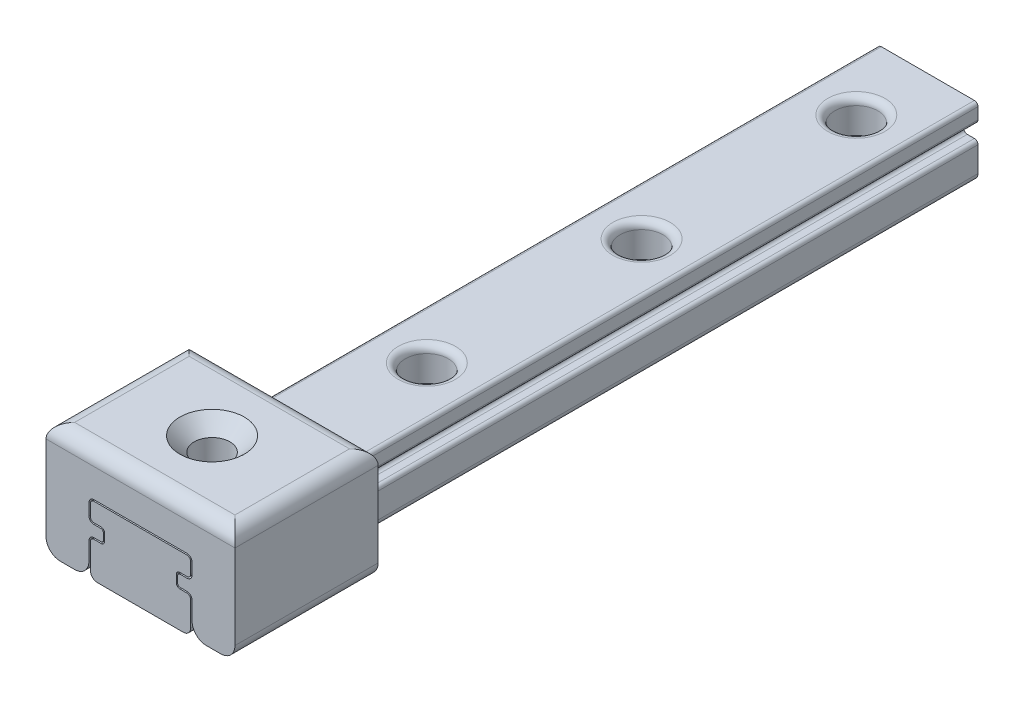
from build123d import *

# Parameters (mm, degrees)
EXTRUDE_1_DEPTH                = 80
FILLET_1_R                     = 0.25
FILLET_2_R                     = 0.5
SKETCH_2_R                     = 1.5
CUT_EXTRUDE_1_DEPTH            = 2.3
SKETCH_3_R                     = 1.2
CUT_EXTRUDE_2_DEPTH            = 81.344570445
FILLET_3_R                     = 0.5
PATTERN_LINEAR_2_COUNT         = 6
PATTERN_LINEAR_2_PITCH         = 15
FILLET_3_OF_PATTERN_LINEAR_2_R = 0.5
SKETCH_4_W                     = 7.607362056
SKETCH_4_H                     = 5.534224128
CUT_EXTRUDE_3_DEPTH            = 25
EXTRUDE_START                  = -55
EXTRUDE_2_DEPTH                = 10
FILLET_4_R                     = 1
MM_START                       = 4.9
MM_1_OUTLINE_R                 = 1.25
MM_1_DEPTH                     = 3
CHAMFER_1_SIZE                 = 1


# Read off the part's stored shape, not the designer's step: 大小mm 暗销孔1
with BuildPart() as part:
    # 草图1 → 凸台-拉伸1 (new body)
    with BuildSketch(Plane.XY):
        Polygon((7, 2.5), (7, 0), (0, 0), (0, 2.5), (1, 2.5), (1, 3.5), (0, 3.5), (0, 4.8), (7, 4.8), (7, 3.5), (6, 3.5), (6, 2.5), align=None)
    extrude(amount=EXTRUDE_1_DEPTH)

    # 圆角1
    fillet_1_edges = [part.edges().sort_by_distance(p)[0] for p in [
        (0, 2.5, 40),
        (1, 2.5, 40),
        (1, 3.5, 40),
        (0, 3.5, 40),
        (0, 4.8, 40),
        (7, 4.8, 40),
        (7, 3.5, 40),
        (6, 3.5, 40),
        (6, 2.5, 40),
        (7, 2.5, 40),
    ]]
    fillet(fillet_1_edges, radius=FILLET_1_R)

    # 圆角2
    fillet_2_edges = [part.edges().sort_by_distance(p)[0] for p in [
        (7, 0, 40),
        (0, 0, 40),
    ]]
    fillet(fillet_2_edges, radius=FILLET_2_R)

    # 草图2 → 切除-拉伸1 (cut)
    with BuildSketch(Plane(origin=(0, 4.8, 0), x_dir=(1, 0, 0), z_dir=(0, 1, 0))):
        with Locations(Location((3.5, -5, 0), (0, 0, 270))):
            Circle(SKETCH_2_R)
    cut_extrude_1 = extrude(amount=-CUT_EXTRUDE_1_DEPTH, mode=Mode.SUBTRACT)

    # 草图3 → 切除-拉伸2 (cut, through all)
    with BuildSketch(Plane(origin=(0, 2.5, 0), x_dir=(1, 0, 0), z_dir=(0, 1, 0))):
        with Locations(Location((3.5, -5, 0), (0, 0, 270))):
            Circle(SKETCH_3_R)
    cut_extrude_2 = extrude(amount=-CUT_EXTRUDE_2_DEPTH, mode=Mode.SUBTRACT)

    # 圆角3
    fillet_3_edges = [part.edges().sort_by_distance(p)[0] for p in [
        (3.5, 4.8, 3.5),
    ]]
    fillet(fillet_3_edges, radius=FILLET_3_R)

    # 阵列(线性)2: 切除-拉伸1, 切除-拉伸2 ×6
    with Locations(*[(0, 0, i * PATTERN_LINEAR_2_PITCH) for i in range(1, PATTERN_LINEAR_2_COUNT)]):
        add(cut_extrude_1, mode=Mode.SUBTRACT)
        add(cut_extrude_2, mode=Mode.SUBTRACT)

    # 圆角3 of 阵列(线性)2
    fillet_3_of_pattern_linear_2_edges = [part.edges().sort_by_distance(p)[0] for p in [
        (3.5, 4.8, 18.5),
        (3.5, 4.8, 33.5),
        (3.5, 4.8, 48.5),
        (3.5, 4.8, 63.5),
        (3.5, 4.8, 78.5),
    ]]
    fillet(fillet_3_of_pattern_linear_2_edges, radius=FILLET_3_OF_PATTERN_LINEAR_2_R)

    # 草图4 → 切除-拉伸3 (cut)
    with BuildSketch(Plane.XY.offset(80)):
        with Locations((3.651776821, 2.327683724)):
            Rectangle(SKETCH_4_W, SKETCH_4_H)
    extrude(amount=-CUT_EXTRUDE_3_DEPTH, mode=Mode.SUBTRACT)


with BuildPart() as body_2:
    # 草图5 → 凸台-拉伸2 (new body)
    with BuildSketch(Plane(origin=(0, 0, 0), x_dir=(-1, 0, 0), z_dir=(0, 0, -1)).offset(EXTRUDE_START)):
        with BuildLine():
            ThreePointArc((0.1, 4.55), (-0.002512627, 4.797487373), (-0.25, 4.9))
            Line((-0.25, 4.9), (-6.75, 4.9))
            ThreePointArc((-6.75, 4.9), (-6.997487373, 4.797487373), (-7.1, 4.55))
            Line((-7.1, 4.55), (-7.1, 3.75))
            ThreePointArc((-7.1, 3.75), (-6.997487373, 3.502512627), (-6.75, 3.4))
            Line((-6.75, 3.4), (-6.25, 3.4))
            ThreePointArc((-6.25, 3.4), (-6.143933983, 3.356066017), (-6.1, 3.25))
            Line((-6.1, 3.25), (-6.1, 2.75))
            ThreePointArc((-6.1, 2.75), (-6.143933983, 2.643933983), (-6.25, 2.6))
            Line((-6.25, 2.6), (-6.75, 2.6))
            ThreePointArc((-6.75, 2.6), (-6.997487373, 2.497487373), (-7.1, 2.25))
            Line((-7.1, 2.25), (-7.1, 0))
            Line((-7.1, 0), (-10.1, 0))
            Line((-10.1, 0), (-10.1, 7.9))
            Line((-10.1, 7.9), (3.1, 7.9))
            Line((3.1, 7.9), (3.1, 0))
            Line((3.1, 0), (0.1, 0))
            Line((0.1, 0), (0.1, 2.25))
            ThreePointArc((0.1, 2.25), (-0.002512627, 2.497487373), (-0.25, 2.6))
            Line((-0.25, 2.6), (-0.75, 2.6))
            ThreePointArc((-0.75, 2.6), (-0.856066017, 2.643933983), (-0.9, 2.75))
            Line((-0.9, 2.75), (-0.9, 3.25))
            ThreePointArc((-0.9, 3.25), (-0.856066017, 3.356066017), (-0.75, 3.4))
            Line((-0.75, 3.4), (-0.25, 3.4))
            ThreePointArc((-0.25, 3.4), (-0.002512627, 3.502512627), (0.1, 3.75))
            Line((0.1, 3.75), (0.1, 4.55))
        make_face()
    extrude(amount=EXTRUDE_2_DEPTH)

    # 圆角4
    fillet_4_edges = [body_2.edges().sort_by_distance(p)[0] for p in [
        (3.5, 7.9, 55),
        (3.5, 7.9, 45),
        (-0.1, 0, 50),
        (-3.1, 0, 50),
        (-3.1, 7.9, 50),
        (10.1, 7.9, 50),
        (10.1, 0, 50),
        (7.1, 0, 50),
    ]]
    fillet(fillet_4_edges, radius=FILLET_4_R)

    # 大小mm 暗销孔1 outline → 大小mm 暗销孔1 (cut)
    with BuildSketch(Plane(origin=(0, 0, 0), x_dir=(1, 0, 0), z_dir=(0, 1, 0)).offset(MM_START)):
        with Locations((3.5, -50)):
            Circle(MM_1_OUTLINE_R)
    extrude(amount=MM_1_DEPTH, mode=Mode.SUBTRACT)

    # 倒角1
    chamfer_1_edges = [body_2.edges().sort_by_distance(p)[0] for p in [
        (2.25, 7.9, 50),
    ]]
    chamfer(chamfer_1_edges, length=CHAMFER_1_SIZE)


solid = Compound([part.part, body_2.part])
